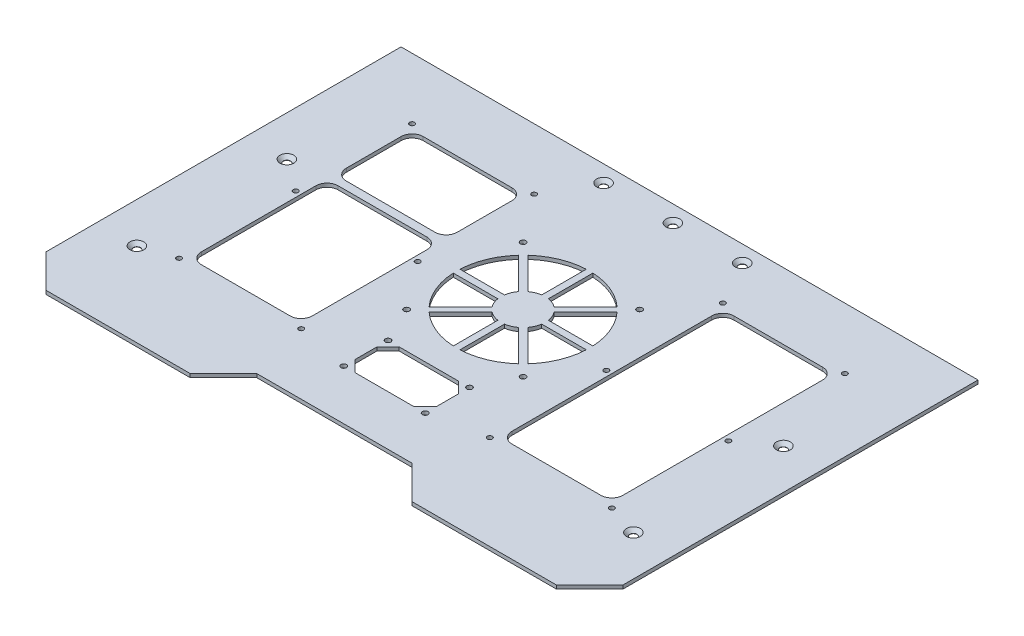
from build123d import *

# Parameters (mm, degrees)
SKETCH1_W           = 520
SKETCH1_H           = 350
BASE_FLANGE1_DEPTH  = 3.26
SKETCH6_R           = 3.25
CUT_EXTRUDE1_DEPTH  = 10
SKETCH7_R           = 3.25
CUT_EXTRUDE2_DEPTH  = 10
SKETCH9_W           = 140
SKETCH9_H           = 30
CUT_EXTRUDE3_DEPTH  = 6.35
CHAMFER1_SIZE       = 30
SKETCH10_R          = 2.5
CUT_EXTRUDE4_DEPTH  = 10
SKETCH11_R          = 2.25
SKETCH11_W          = 100
SKETCH11_H          = 200
CUT_EXTRUDE5_DEPTH  = 10
SKETCH12_W          = 100
SKETCH12_H          = 7.375
BOSS_EXTRUDE2_DEPTH = 3.26
FILLET1_R           = 10
SKETCH13_W          = 73.414309182
SKETCH13_H          = 40
CUT_EXTRUDE6_DEPTH  = 10
CHAMFER2_SIZE       = 10
SKETCH14_R          = 2.5
CUT_EXTRUDE7_DEPTH  = 10
CHAMFER3_SIZE       = 3


# Sheet-metal steps are written as plain solids
with BuildPart() as part:
    # Sketch1 → Base-Flange1 (new body)
    with BuildSketch(Plane(origin=(0, 0, 0), x_dir=(1, 0, 0), z_dir=(0, 1, 0))):
        with Locations((0, -175)):
            Rectangle(SKETCH1_W, SKETCH1_H)
    extrude(amount=-BASE_FLANGE1_DEPTH)

    # Sketch6 → Cut-Extrude1 (cut)
    with BuildSketch(Plane(origin=(0, 0, 0), x_dir=(1, 0, 0), z_dir=(0, 1, 0))):
        with Locations(Location((62.5, -14.9625, 0), (0, 0, 270))):
            Circle(SKETCH6_R)
        with Locations(Location((0, -14.9625, 0), (0, 0, 270))):
            Circle(SKETCH6_R)
        with Locations(Location((-62.5, -14.9625, 0), (0, 0, 270))):
            Circle(SKETCH6_R)
    extrude(amount=-CUT_EXTRUDE1_DEPTH, mode=Mode.SUBTRACT)

    # Sketch7 → Cut-Extrude2 (cut)
    with BuildSketch(Plane(origin=(0, 0, 0), x_dir=(1, 0, 0), z_dir=(0, 1, 0))):
        with Locations(Location((-223.749160028, -139.138800169, 0), (0, 0, 270))):
            Circle(SKETCH7_R)
        with Locations(Location((-223.749160028, -274.331266718, 0), (0, 0, 270))):
            Circle(SKETCH7_R)
        with Locations(Location((223.749160028, -274.331266718, 0), (0, 0, 90))):
            Circle(SKETCH7_R)
        with Locations(Location((223.749160028, -139.138800169, 0), (0, 0, 90))):
            Circle(SKETCH7_R)
    extrude(amount=-CUT_EXTRUDE2_DEPTH, mode=Mode.SUBTRACT)

    # Sketch9 → Cut-Extrude3 (cut)
    with BuildSketch(Plane(origin=(0, 0, 0), x_dir=(1, 0, 0), z_dir=(0, 1, 0))):
        with Locations((0, -335)):
            Rectangle(SKETCH9_W, SKETCH9_H)
    extrude(amount=-CUT_EXTRUDE3_DEPTH, mode=Mode.SUBTRACT)

    # Chamfer1
    chamfer1_edges = [part.edges().sort_by_distance(p)[0] for p in [
        (260, -1.63, 350),
        (-260, -1.63, 350),
        (70, -1.63, 350),
        (-70, -1.63, 350),
    ]]
    chamfer(chamfer1_edges, length=CHAMFER1_SIZE - 0.0001)  # a hair under: the kernel refuses the full size

    # Sketch10 → Cut-Extrude4 (cut)
    with BuildSketch(Plane(origin=(0, 0, 0), x_dir=(1, 0, 0), z_dir=(0, 1, 0))):
        with Locations(Location((-52.5, -97.5, 0), (0, 0, 270))):
            Circle(SKETCH10_R)
        with Locations(Location((52.5, -97.5, 0), (0, 0, 270))):
            Circle(SKETCH10_R)
        with Locations(Location((52.5, -202.5, 0), (0, 0, 270))):
            Circle(SKETCH10_R)
        with Locations(Location((-52.5, -202.5, 0), (0, 0, 270))):
            Circle(SKETCH10_R)
        with BuildLine():
            Line((-3, -209.924953066), (-3, -169.773719933))
            ThreePointArc((-3, -169.773719933), (-7.653668647, -168.47759065), (-11.860811111, -166.103451798))
            Line((-11.860811111, -166.103451798), (-40.252020332, -194.494661019))
            ThreePointArc((-40.252020332, -194.494661019), (-22.961005942, -205.432771951), (-3, -209.924953066))
        make_face()
        with BuildLine():
            Line((-3, -90.075046934), (-3, -130.226280067))
            ThreePointArc((-3, -130.226280067), (-7.653668647, -131.52240935), (-11.860811111, -133.896548202))
            Line((-11.860811111, -133.896548202), (-40.252020332, -105.505338981))
            ThreePointArc((-40.252020332, -105.505338981), (-22.961005942, -94.567228049), (-3, -90.075046934))
        make_face()
        with BuildLine():
            Line((-19.773719933, -147), (-59.924953066, -147))
            ThreePointArc((-59.924953066, -147), (-55.432771951, -127.038994058), (-44.494661019, -109.747979668))
            Line((-44.494661019, -109.747979668), (-16.103451798, -138.139188889))
            ThreePointArc((-16.103451798, -138.139188889), (-18.47759065, -142.346331353), (-19.773719933, -147))
        make_face()
        with BuildLine():
            Line((-19.773719933, -153), (-59.924953066, -153))
            ThreePointArc((-59.924953066, -153), (-55.432771951, -172.961005942), (-44.494661019, -190.252020332))
            Line((-44.494661019, -190.252020332), (-16.103451798, -161.860811111))
            ThreePointArc((-16.103451798, -161.860811111), (-18.47759065, -157.653668647), (-19.773719933, -153))
        make_face()
        with BuildLine():
            Line((3, -209.924953066), (3, -169.773719933))
            ThreePointArc((3, -169.773719933), (7.653668647, -168.47759065), (11.860811111, -166.103451798))
            Line((11.860811111, -166.103451798), (40.252020332, -194.494661019))
            ThreePointArc((40.252020332, -194.494661019), (22.961005942, -205.432771951), (3, -209.924953066))
        make_face()
        with BuildLine():
            Line((44.494661019, -190.252020332), (16.103451798, -161.860811111))
            ThreePointArc((16.103451798, -161.860811111), (18.47759065, -157.653668647), (19.773719933, -153))
            Line((19.773719933, -153), (59.924953066, -153))
            ThreePointArc((59.924953066, -153), (55.432771951, -172.961005942), (44.494661019, -190.252020332))
        make_face()
        with BuildLine():
            Line((19.773719933, -147), (59.924953066, -147))
            ThreePointArc((59.924953066, -147), (55.432771951, -127.038994058), (44.494661019, -109.747979668))
            Line((44.494661019, -109.747979668), (16.103451798, -138.139188889))
            ThreePointArc((16.103451798, -138.139188889), (18.47759065, -142.346331353), (19.773719933, -147))
        make_face()
        with BuildLine():
            Line((40.252020332, -105.505338981), (11.860811111, -133.896548202))
            ThreePointArc((11.860811111, -133.896548202), (7.653668647, -131.52240935), (3, -130.226280067))
            Line((3, -130.226280067), (3, -90.075046934))
            ThreePointArc((3, -90.075046934), (22.961005942, -94.567228049), (40.252020332, -105.505338981))
        make_face()
    extrude(amount=-CUT_EXTRUDE4_DEPTH, mode=Mode.SUBTRACT)

    # Sketch11 → Cut-Extrude5 (cut)
    with BuildSketch(Plane(origin=(0, 0, 0), x_dir=(1, 0, 0), z_dir=(0, 1, 0))):
        with Locations(Location((-195, -265, 0), (0, 0, 270))):
            Circle(SKETCH11_R)
        with Locations(Location((-195, -55, 0), (0, 0, 270))):
            Circle(SKETCH11_R)
        with Locations(Location((-85, -55, 0), (0, 0, 270))):
            Circle(SKETCH11_R)
        with Locations(Location((-85, -265, 0), (0, 0, 270))):
            Circle(SKETCH11_R)
        with Locations(Location((-85, -160, 0), (0, 0, 270))):
            Circle(SKETCH11_R)
        with Locations(Location((-195, -160, 0), (0, 0, 270))):
            Circle(SKETCH11_R)
        with Locations(Location((195, -160, 0), (0, 0, 270))):
            Circle(SKETCH11_R)
        with Locations(Location((85, -160, 0), (0, 0, 270))):
            Circle(SKETCH11_R)
        with Locations(Location((85, -265, 0), (0, 0, 270))):
            Circle(SKETCH11_R)
        with Locations(Location((85, -55, 0), (0, 0, 270))):
            Circle(SKETCH11_R)
        with Locations(Location((195, -55, 0), (0, 0, 270))):
            Circle(SKETCH11_R)
        with Locations(Location((195, -265, 0), (0, 0, 270))):
            Circle(SKETCH11_R)
        with Locations((-140, -160)):
            Rectangle(SKETCH11_W, SKETCH11_H)
        with Locations((140, -160)):
            Rectangle(SKETCH11_W, SKETCH11_H)
    extrude(amount=-CUT_EXTRUDE5_DEPTH, mode=Mode.SUBTRACT)

    # Sketch12 → Boss-Extrude2 (add)
    with BuildSketch(Plane(origin=(0, 0, 0), x_dir=(1, 0, 0), z_dir=(0, 1, 0))):
        with Locations((-140, -133.068919425)):
            Rectangle(SKETCH12_W, SKETCH12_H)
    extrude(amount=-BOSS_EXTRUDE2_DEPTH)

    # Fillet1
    fillet1_edges = [part.edges().sort_by_distance(p)[0] for p in [
        (-90, -1.63, 60),
        (-90, -1.63, 260),
        (-190, -1.63, 260),
        (-190, -1.63, 60),
        (190, -1.63, 60),
        (190, -1.63, 260),
        (90, -1.63, 260),
        (90, -1.63, 60),
        (-190, -1.63, 136.756419425),
        (-190, -1.63, 129.381419425),
        (-90, -1.63, 129.381419425),
        (-90, -1.63, 136.756419425),
    ]]
    fillet(fillet1_edges, radius=FILLET1_R)

    # Sketch13 → Cut-Extrude6 (cut)
    with BuildSketch(Plane(origin=(0, 0, 0), x_dir=(1, 0, 0), z_dir=(0, 1, 0))):
        with Locations((0, -255)):
            Rectangle(SKETCH13_W, SKETCH13_H)
    extrude(amount=-CUT_EXTRUDE6_DEPTH, mode=Mode.SUBTRACT)

    # Chamfer2
    chamfer2_edges = [part.edges().sort_by_distance(p)[0] for p in [
        (36.707154591, -1.63, 235),
        (36.707154591, -1.63, 275),
        (-36.707154591, -1.63, 275),
        (-36.707154591, -1.63, 235),
    ]]
    chamfer(chamfer2_edges, length=CHAMFER2_SIZE)

    # Sketch14 → Cut-Extrude7 (cut)
    with BuildSketch(Plane(origin=(0, 0, 0), x_dir=(1, 0, 0), z_dir=(0, 1, 0))):
        with Locations(Location((-36.707154591, -275, 0), (0, 0, 270))):
            Circle(SKETCH14_R)
        with Locations(Location((-36.707154591, -235, 0), (0, 0, 270))):
            Circle(SKETCH14_R)
        with Locations(Location((36.707154591, -235, 0), (0, 0, 270))):
            Circle(SKETCH14_R)
        with Locations(Location((36.707154591, -275, 0), (0, 0, 270))):
            Circle(SKETCH14_R)
    extrude(amount=-CUT_EXTRUDE7_DEPTH, mode=Mode.SUBTRACT)

    # Chamfer3
    chamfer3_edges = [part.edges().sort_by_distance(p)[0] for p in [
        (62.5, 0, 11.7125),
        (0, 0, 11.7125),
        (-62.5, 0, 11.7125),
        (-223.749160028, 0, 135.888800169),
        (-223.749160028, 0, 271.081266718),
        (223.749160028, 0, 277.581266718),
        (223.749160028, 0, 142.388800169),
    ]]
    chamfer(chamfer3_edges, length=CHAMFER3_SIZE)


solid = part.part
